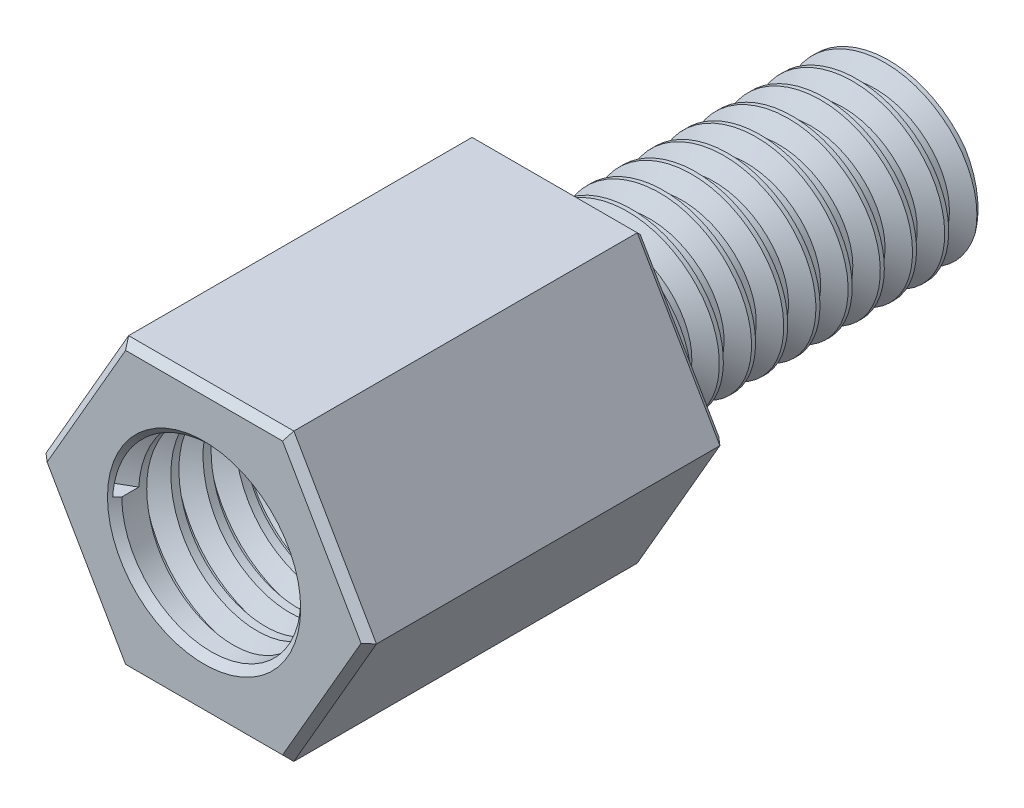
from build123d import *
from build123d.topology import SkipClean

# Parameters (mm, degrees)
BOSS_EXTRUDE1_DEPTH = 5
SKETCH2_R           = 1.25
CUT_EXTRUDE1_DEPTH  = 4
THREAD1_PITCH       = 0.45
CHAMFER1_SIZE       = 0.1
CHAMFER2_SIZE       = 0.1
SKETCH6_R           = 1.25
BOSS_EXTRUDE2_DEPTH = 5
THREAD2_PITCH       = 0.45


with BuildPart() as part:
    # Sketch1 → Boss-Extrude1 (new body)
    with BuildSketch(Plane.XY):
        Polygon((2.309401077, 0), (1.154700538, 2), (-1.154700538, 2), (-2.309401077, 0), (-1.154700538, -2), (1.154700538, -2), align=None)
    extrude(amount=BOSS_EXTRUDE1_DEPTH)

    # Sketch2 → Cut-Extrude1 (cut)
    with BuildSketch(Plane.XY.offset(5)):
        Circle(SKETCH2_R)
    extrude(amount=-CUT_EXTRUDE1_DEPTH, mode=Mode.SUBTRACT)

    # Thread1: the profile of Thread Profile1 profile screwed along a right-hand helix of 8.888889 turns, 6 arcs to a turn; built about Z, then put on its axis
    with SkipClean():  # the faces are left unmerged after this step: merging them gives an invalid solid
        thread1_z = Axis((0, 0, 0), (0, 0, 1))
        thread1_corners = [(1.2497, 0, -0.000173205), (1.493569644, 0, 0.140624999), (1.493569644, 0, 0.196874999), (1.2497, 0, 0.337673204)]
        with BuildLine(mode=Mode.PRIVATE) as thread1_profile:
            Line(thread1_corners[0], thread1_corners[1])
            Line(thread1_corners[1], thread1_corners[2])
            Line(thread1_corners[2], thread1_corners[3])
            Line(thread1_corners[3], thread1_corners[0])
        thread1_cap = Face(thread1_profile.wire())
        thread1_turn_angles = [0, 30, 60, 90, 120, 150, 180, 210, 240, 270, 300, 330, 360]
        thread1_turn_weights = [1, 0.8660254037844387, 1, 0.8660254037844387, 1, 0.8660254037844387, 1, 0.8660254037844387, 1, 0.8660254037844387, 1, 0.8660254037844387, 1]
        thread1_turn_rails = [Edge.make_bspline([Vector(p[0], p[1], 0).rotate(thread1_z, thread1_turn_angles[k]) / thread1_turn_weights[k] + Vector(0, 0, p[2] + THREAD1_PITCH * thread1_turn_angles[k] / 360) for k in range(13)], [0, 0, 0, 1, 1, 2, 2, 3, 3, 4, 4, 5, 5, 6, 6, 6], 2, thread1_turn_weights) for p in thread1_corners]
        thread1_turn_sides = [Face.make_surface_from_curves(thread1_turn_rails[p[0]], thread1_turn_rails[p[1]]) for p in [(0, 1), (1, 2), (2, 3), (3, 0)]]
        thread1_last_angles = [2880, 2910, 2940, 2970, 3000, 3030, 3060, 3090, 3120, 3150, 3180, 3190, 3200]
        thread1_last_weights = [1, 0.8660254037844387, 1, 0.8660254037844387, 1, 0.8660254037844387, 1, 0.8660254037844387, 1, 0.8660254037844387, 1, 0.9848077530122074, 1]
        thread1_last_rails = [Edge.make_bspline([Vector(p[0], p[1], 0).rotate(thread1_z, thread1_last_angles[k]) / thread1_last_weights[k] + Vector(0, 0, p[2] + THREAD1_PITCH * thread1_last_angles[k] / 360) for k in range(13)], [0, 0, 0, 1, 1, 2, 2, 3, 3, 4, 4, 5, 5, 6, 6, 6], 2, thread1_last_weights) for p in thread1_corners]
        thread1_last_sides = [Face.make_surface_from_curves(thread1_last_rails[p[0]], thread1_last_rails[p[1]]) for p in [(0, 1), (1, 2), (2, 3), (3, 0)]]
        thread1 = Plane(origin=(0, 0, 5), x_dir=(-1, 0, 0), z_dir=(0, 0, -1)) * Solid(Shell([*[p.moved(Location((0, 0, THREAD1_PITCH * i))) for i in range(8) for p in thread1_turn_sides], *thread1_last_sides, thread1_cap, thread1_cap.rotate(thread1_z, 3200).moved(Location((0, 0, THREAD1_PITCH * 3200 / 360)))]))
        add(thread1, mode=Mode.SUBTRACT)

    # Chamfer1
    # the kernel refuses this chamfer: 0.1 mm, written as the material it takes off along each edge
    with BuildSketch(Plane(origin=(-1.411868837, -2, 5), x_dir=(-1.0572296056914004e-14, 0.9996219169112966, 0.027495876610587302), z_dir=(1, 0, 0)), Plane(origin=(-2.437985226, 0.22271428, 5), x_dir=(0.8656979742248763, 0.49981095845565526, 0.027495876610587378), z_dir=(0.500000000000007, -0.8660254037844347, 0)), Plane(origin=(-1.026116389, 2.22271428, 5), x_dir=(0.8656979742248833, -0.4998109584556432, 0.027495876610587368), z_dir=(-0.4999999999999949, -0.8660254037844416, 0))) as chamfer1_piece_1:
        Polygon((CHAMFER1_SIZE * 0.999621916911, -CHAMFER1_SIZE * 0.0274958766106), (-CHAMFER1_SIZE * 0.0274958766106, -CHAMFER1_SIZE * 0.999621916911), (0, 0), align=None)
    extrude(amount=2.823737674, mode=Mode.SUBTRACT)
    with BuildSketch(Plane(origin=(1.411868837, 2, 5), x_dir=(0, 0.027495876610585262, -0.9996219169112966), z_dir=(-1, 0, 0)), Plane(origin=(2.437985226, -0.22271428, 5), x_dir=(0.023812127644089322, 0.01374793830529273, -0.9996219169112966), z_dir=(-0.5000000000000009, 0.8660254037844383, 0)), Plane(origin=(1.026116389, -2.22271428, 5), x_dir=(0.023812127644090235, -0.013747938305293037, -0.9996219169112966), z_dir=(0.4999999999999949, 0.8660254037844417, 0))) as chamfer1_piece_2:
        Polygon((CHAMFER1_SIZE * 0.999621916911, CHAMFER1_SIZE * 0.0274958766106), (-CHAMFER1_SIZE * 0.0274958766106, CHAMFER1_SIZE * 0.999621916911), (0, 0), align=None)
    extrude(amount=2.823737674, mode=Mode.SUBTRACT)
    with BuildSketch(Plane(origin=(0, 0, 5), x_dir=(1, 0, 0), z_dir=(0, -1, 0))) as chamfer1_piece_3:
        Polygon((1.25 + CHAMFER1_SIZE, 0), (1.25, -CHAMFER1_SIZE), (1.25, 0), align=None)
    revolve(axis=Axis((0, 0, 5), (0, 0, 1)), revolution_arc=180, mode=Mode.SUBTRACT)
    with BuildSketch(Plane(origin=(0, 0, 5), x_dir=(-1, 0, 0), z_dir=(0, 1, 0))) as chamfer1_piece_4:
        Polygon((1.25 + CHAMFER1_SIZE, 0), (1.25, -CHAMFER1_SIZE), (1.25, 0), align=None)
    revolve(axis=Axis((0, 0, 5), (0, 0, 1)), revolution_arc=180, mode=Mode.SUBTRACT)

    # Chamfer2
    chamfer2_edges = [part.edges().sort_by_distance(p)[0] for p in [
        (0, -2, 0),
        (-1.732050808, -1, 0),
        (-1.732050808, 1, 0),
        (0, 2, 0),
        (1.732050808, 1, 0),
        (1.732050808, -1, 0),
    ]]
    chamfer(chamfer2_edges, length=CHAMFER2_SIZE)

    # Sketch6 → Boss-Extrude2 (add)
    with BuildSketch(Plane(origin=(0, 0, 0), x_dir=(-1, 0, 0), z_dir=(0, 0, -1))):
        Circle(SKETCH6_R)
    extrude(amount=BOSS_EXTRUDE2_DEPTH)

    # Thread2: the profile of Thread Profile2 profile screwed along a right-hand helix of 11.111111 turns, 6 arcs to a turn; built about Z, then put on its axis
    thread2_z = Axis((0, 0, 0), (0, 0, 1))
    thread2_corners = [(1.2503, 0, -0.000173205), (1.2503, 0, 0.393923204), (1.006430356, 0, 0.253124999), (1.006430356, 0, 0.140624999)]
    with BuildLine(mode=Mode.PRIVATE) as thread2_profile:
        Line(thread2_corners[0], thread2_corners[1])
        Line(thread2_corners[1], thread2_corners[2])
        Line(thread2_corners[2], thread2_corners[3])
        Line(thread2_corners[3], thread2_corners[0])
    thread2_cap = Face(thread2_profile.wire())
    thread2_turn_angles = [0, 30, 60, 90, 120, 150, 180, 210, 240, 270, 300, 330, 360]
    thread2_turn_weights = [1, 0.8660254037844387, 1, 0.8660254037844387, 1, 0.8660254037844387, 1, 0.8660254037844387, 1, 0.8660254037844387, 1, 0.8660254037844387, 1]
    thread2_turn_rails = [Edge.make_bspline([Vector(p[0], p[1], 0).rotate(thread2_z, thread2_turn_angles[k]) / thread2_turn_weights[k] + Vector(0, 0, p[2] + THREAD2_PITCH * thread2_turn_angles[k] / 360) for k in range(13)], [0, 0, 0, 1, 1, 2, 2, 3, 3, 4, 4, 5, 5, 6, 6, 6], 2, thread2_turn_weights) for p in thread2_corners]
    thread2_turn_sides = [Face.make_surface_from_curves(thread2_turn_rails[p[0]], thread2_turn_rails[p[1]]) for p in [(0, 1), (1, 2), (2, 3), (3, 0)]]
    thread2_last_angles = [3960, 3980, 4000]
    thread2_last_weights = [1, 0.939692620785907, 1]
    thread2_last_rails = [Edge.make_bspline([Vector(p[0], p[1], 0).rotate(thread2_z, thread2_last_angles[k]) / thread2_last_weights[k] + Vector(0, 0, p[2] + THREAD2_PITCH * thread2_last_angles[k] / 360) for k in range(3)], [0, 0, 0, 1, 1, 1], 2, thread2_last_weights) for p in thread2_corners]
    thread2_last_sides = [Face.make_surface_from_curves(thread2_last_rails[p[0]], thread2_last_rails[p[1]]) for p in [(0, 1), (1, 2), (2, 3), (3, 0)]]
    thread2 = Plane(origin=(0, 0, -5), x_dir=(1, 0, 0), z_dir=(0, 0, 1)) * Solid(Shell([*[p.moved(Location((0, 0, THREAD2_PITCH * i))) for i in range(11) for p in thread2_turn_sides], *thread2_last_sides, thread2_cap, thread2_cap.rotate(thread2_z, 4000).moved(Location((0, 0, THREAD2_PITCH * 4000 / 360)))]))
    add(thread2, mode=Mode.SUBTRACT)

    # Sketch7 → Cut-Revolve1 (revolve, cut)
    with BuildSketch(Plane(origin=(0, 0, 0), x_dir=(1, 0, 0), z_dir=(0, 1, 0)), mode=Mode.PRIVATE) as cut_revolve1_sk:
        Polygon((-0.361736249, 5), (-1.450761809, 4.469949093), (-1.450761809, 5.273328604), (-0.361736249, 5.273328604), align=None)
    revolve(cut_revolve1_sk.sketch.rotate(Axis((0, 0, -10), (0, 0, 1)), 165.33609495), axis=Axis((0, 0, -10), (0, 0, 1)), mode=Mode.SUBTRACT)


solid = part.part
